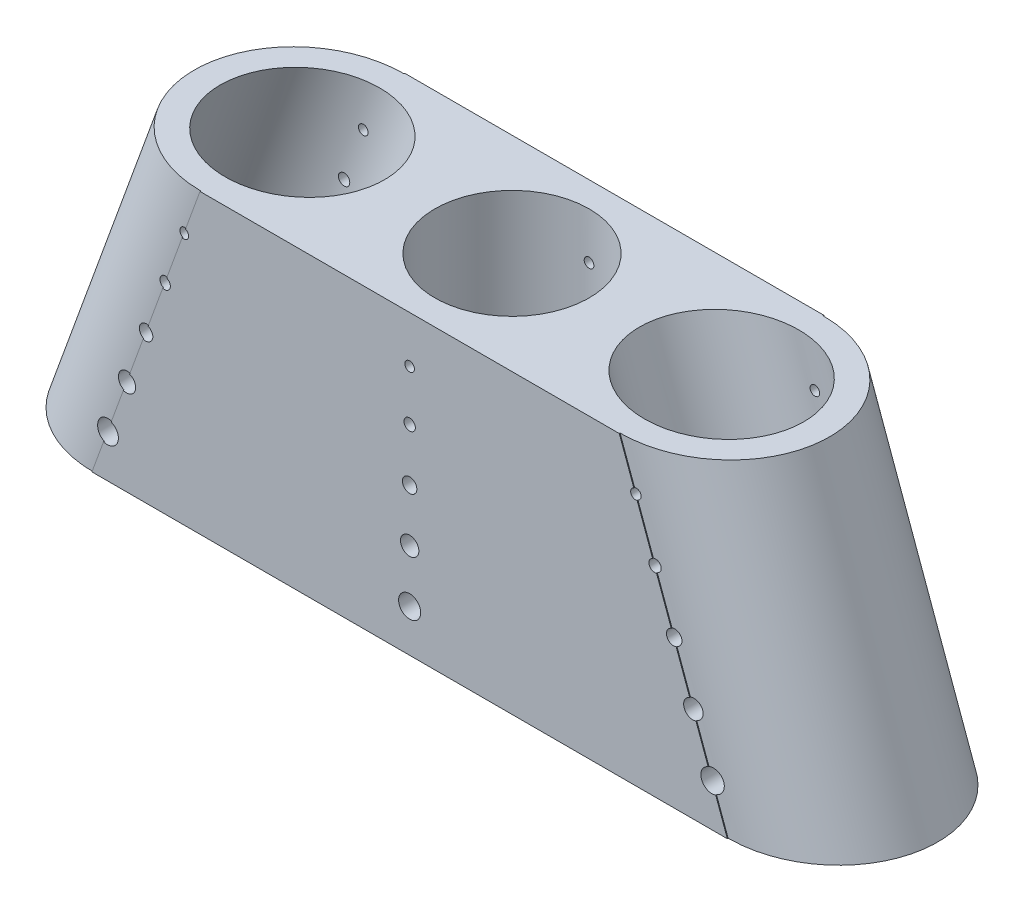
from build123d import *

# Parameters (mm, degrees)
NOSECONE_OUTLINE_W        = 175
NOSECONE_OUTLINE_H        = 46.415394853
BOSS_EXTRUDE1_DEPTH       = 16
SKETCH4_W                 = 12.065
SKETCH4_H                 = 46.415394853
CUT_REVOLVE9_START        = -29.926762541
CUT_REVOLVE9_DEPTH        = 104.926762541
TAP_DRILL_FOR_1_64_TAP1_D = 1.5113
TAP_DRILL_FOR_2_64_TAP1_D = 1.778
TAP_DRILL_FOR_4_40_TAP1_D = 2.2606
TAP_DRILL_FOR_6_40_TAP1_D = 2.8702
TAP_DRILL_FOR_8_36_TAP1_D = 3.4544


with BuildPart() as part:
    # nosecone outline → Boss-Extrude1 (new, symmetric)
    with BuildSketch(Plane.XY):
        with Locations((0, -23.207697427)):
            Rectangle(NOSECONE_OUTLINE_W, NOSECONE_OUTLINE_H)
    extrude(amount=BOSS_EXTRUDE1_DEPTH, both=True)

    # Sketch2 → Cut-Revolve4 (revolve, cut)
    with BuildSketch(Plane.XY):
        Polygon((45.608126963, 0), (45.055226666, 1.51908108), (32.215921841, 1.51908108), (49.662644276, -46.415394853), (62.501949101, -46.415394853), align=None)
        Polygon((45.055226666, 1.51908108), (42.130011825, 9.556042805), (25.780723397, 54.475343584), (12.941418572, 54.475343584), (32.215921841, 1.51908108), align=None)
    cut_revolve4 = revolve(axis=Axis((31.302031424, 4.029974366, 0), (-0.3420201433256666, 0.9396926207859092, 0)), mode=Mode.SUBTRACT)

    # Sketch4 → Cut-Revolve5 (revolve, cut)
    with BuildSketch(Plane.XY, mode=Mode.PRIVATE) as cut_revolve5_sk:
        with Locations((-6.0325, -23.207697427)):
            Rectangle(SKETCH4_W, SKETCH4_H)
    revolve(cut_revolve5_sk.sketch.rotate(Axis((0, 4.078123147, 0), (0, 1, 0)), 270), axis=Axis((0, 4.078123147, 0), (0, 1, 0)), mode=Mode.SUBTRACT)

    # Cut-Revolve9: read off the stored shape, not the designer's step
    # Cut-Revolve9 outline → Cut-Revolve9 (cut)
    with BuildSketch(Plane(origin=(0, 0, 0), x_dir=(0.939692620785909, 0.3420201433256671, 0), z_dir=(0.34202014332566705, -0.9396926207859091, 0)).offset(CUT_REVOLVE9_START)):
        with BuildLine():
            ThreePointArc((30.792620355, 15.875), (46.667620355, 0), (30.792620355, -15.875))
            Line((30.792620355, -15.875), (30.792620355, -16))
            Line((30.792620355, -16), (84, -16))
            Line((84, -16), (84, 16))
            Line((84, 16), (30.792620355, 16))
            Line((30.792620355, 16), (30.792620355, 15.875))
        make_face()
    cut_revolve9 = extrude(amount=CUT_REVOLVE9_DEPTH, mode=Mode.SUBTRACT)

    # Mirror2: Cut-Revolve4, Cut-Revolve9 across plane
    add(cut_revolve4.mirror(Plane(origin=(0, 0, 0), x_dir=(0, 0, 1), z_dir=(1, 0, 0))), mode=Mode.SUBTRACT)
    add(cut_revolve9.mirror(Plane(origin=(0, 0, 0), x_dir=(0, 0, 1), z_dir=(1, 0, 0))), mode=Mode.SUBTRACT)

    # Tap Drill for #1-64 Tap1 (through all)
    with Locations(Plane(origin=(-35.299027927, -6.951683272, 16), x_dir=(1, 0, 0), z_dir=(0, 0, 1))):
        with Locations((0, 0), (35.299027927, -0.349382345)):
            tap_drill_for_1_64_tap1 = Hole(TAP_DRILL_FOR_1_64_TAP1_D / 2)

    # Tap Drill for #2-64 Tap1 (through all)
    with Locations(Plane(origin=(-38.287313872, -15.161931428, 16), x_dir=(1, 0, 0), z_dir=(0, 0, 1))):
        with Locations((0, 0), (38.287313872, 0)):
            tap_drill_for_2_64_tap1 = Hole(TAP_DRILL_FOR_2_64_TAP1_D / 2)

    # Tap Drill for #4-40 Tap1 (through all)
    with Locations(Plane(origin=(-41.275599817, -23.372179584, 16), x_dir=(1, 0, 0), z_dir=(0, 0, 1))):
        with Locations((0, 0), (41.275599817, 0)):
            tap_drill_for_4_40_tap1 = Hole(TAP_DRILL_FOR_4_40_TAP1_D / 2)

    # Tap Drill for #6-40 Tap1 (through all)
    with Locations(Plane(origin=(-44.263885761, -31.58242774, 16), x_dir=(1, 0, 0), z_dir=(0, 0, 1))):
        with Locations((0, 0), (44.263885761, 0)):
            tap_drill_for_6_40_tap1 = Hole(TAP_DRILL_FOR_6_40_TAP1_D / 2)

    # Tap Drill for #8-36 Tap1 (through all)
    with Locations(Plane(origin=(-47.252171706, -39.792675897, 16), x_dir=(1, 0, 0), z_dir=(0, 0, 1))):
        with Locations((0, 0), (47.252171706, 0)):
            tap_drill_for_8_36_tap1 = Hole(TAP_DRILL_FOR_8_36_TAP1_D / 2)

    # Mirror3: Tap Drill for #1-64 Tap1, Tap Drill for #2-64 Tap1, Tap Drill for #4-40 Tap1, Tap Drill for #6-40 Tap1, Tap Drill for #8-36 Tap1 across plane
    add(tap_drill_for_1_64_tap1.mirror(Plane(origin=(0, 0, 0), x_dir=(0, 0, 1), z_dir=(1, 0, 0))), mode=Mode.SUBTRACT)
    add(tap_drill_for_2_64_tap1.mirror(Plane(origin=(0, 0, 0), x_dir=(0, 0, 1), z_dir=(1, 0, 0))), mode=Mode.SUBTRACT)
    add(tap_drill_for_4_40_tap1.mirror(Plane(origin=(0, 0, 0), x_dir=(0, 0, 1), z_dir=(1, 0, 0))), mode=Mode.SUBTRACT)
    add(tap_drill_for_6_40_tap1.mirror(Plane(origin=(0, 0, 0), x_dir=(0, 0, 1), z_dir=(1, 0, 0))), mode=Mode.SUBTRACT)
    add(tap_drill_for_8_36_tap1.mirror(Plane(origin=(0, 0, 0), x_dir=(0, 0, 1), z_dir=(1, 0, 0))), mode=Mode.SUBTRACT)


solid = part.part
